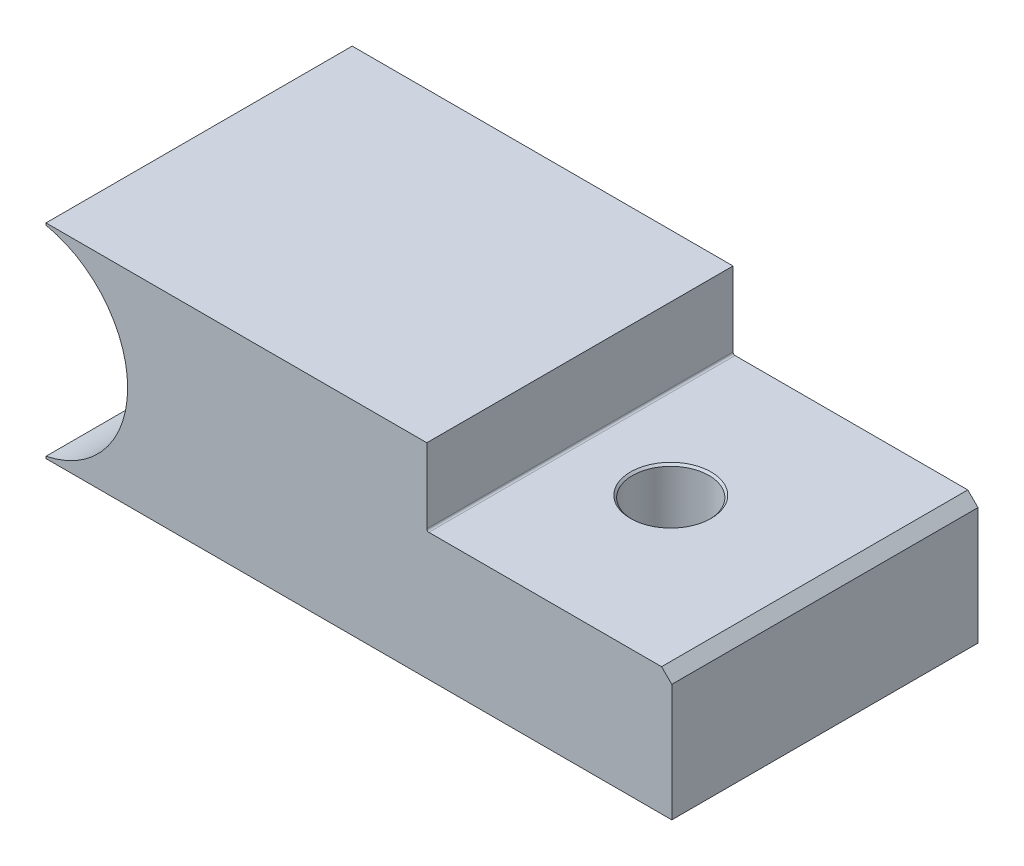
from build123d import *

# Parameters (mm, degrees)
BOSS_EXTRUDE1_DEPTH          = 38.1
F_3_8_0_375_DIAMETER_HOLE1_D = 9.525
CHAMFER1_SIZE                = 1.27
CHAMFER2_SIZE                = 0.254
FILLET1_R                    = 0.254


with BuildPart() as part:
    # Sketch1 → Boss-Extrude1 (new body)
    with BuildSketch(Plane.XY):
        with BuildLine():
            Line((2.54, 0), (80.402581892, 0))
            Line((80.402581892, 0), (80.402581892, 15.875))
            Line((80.402581892, 15.875), (49.922581892, 15.875))
            Line((49.922581892, 15.875), (49.922581892, 25.4))
            Line((49.922581892, 25.4), (2.54, 25.4))
            Line((2.54, 25.4), (2.54, 25.143407893))
            ThreePointArc((2.54, 25.143407893), (12.7, 12.7), (2.54, 0.256592107))
            Line((2.54, 0.256592107), (2.54, 0))
        make_face()
    extrude(amount=BOSS_EXTRUDE1_DEPTH)

    # 3/8 (0.375) Diameter Hole1 (through all)
    with Locations(Plane(origin=(0, 15.875, 0), x_dir=(1, 0, 0), z_dir=(0, 1, 0))):
        with Locations((61.225684, -19.05)):
            Hole(F_3_8_0_375_DIAMETER_HOLE1_D / 2)

    # Chamfer1
    chamfer1_edges = [part.edges().sort_by_distance(p)[0] for p in [
        (80.402581892, 15.875, 19.05),
    ]]
    chamfer(chamfer1_edges, length=CHAMFER1_SIZE)

    # Chamfer2
    chamfer2_edges = [part.edges().sort_by_distance(p)[0] for p in [
        (65.988184, 15.875, 19.05),
    ]]
    chamfer(chamfer2_edges, length=CHAMFER2_SIZE)

    # Fillet1
    fillet1_edges = [part.edges().sort_by_distance(p)[0] for p in [
        (49.922581892, 15.875, 19.05),
    ]]
    fillet(fillet1_edges, radius=FILLET1_R)


solid = part.part
